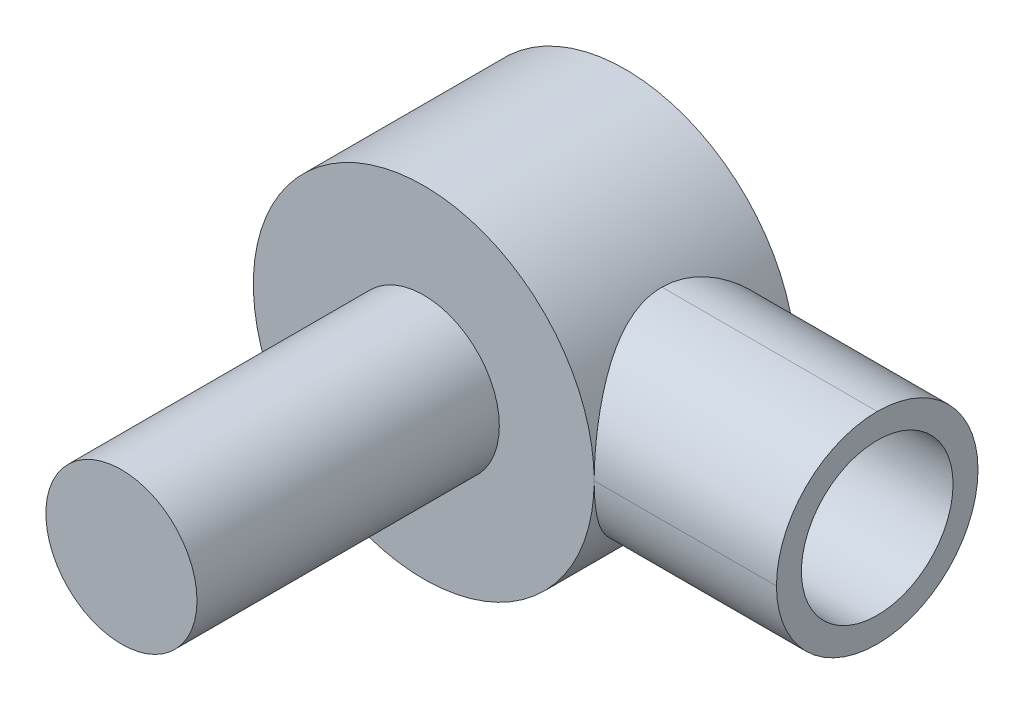
from build123d import *

# Parameters (mm, degrees)
BOSS_EXTRUDE1_DEPTH = 40
SKETCH2_R           = 15.05
CUT_EXTRUDE1_DEPTH  = 40
FILLET1_R           = 20
SKETCH3_R           = 15
BOSS_EXTRUDE2_DEPTH = 60


with BuildPart() as part:
    # Sketch1 → Boss-Extrude1 (new body)
    with BuildSketch(Plane.XY):
        with BuildLine():
            Line((27.270825141, -20), (70, -20))
            Line((70, -20), (70, 20))
            Line((70, 20), (27.270825141, 20))
            ThreePointArc((27.270825141, 20), (-33.818602926, 0), (27.270825141, -20))
        make_face()
    extrude(amount=BOSS_EXTRUDE1_DEPTH)

    # Sketch2 → Cut-Extrude1 (cut)
    with BuildSketch(Plane(origin=(70, 0, 0), x_dir=(0, 0, -1), z_dir=(1, 0, 0))):
        with Locations((-20, 0)):
            Circle(SKETCH2_R)
    extrude(amount=-CUT_EXTRUDE1_DEPTH, mode=Mode.SUBTRACT)

    # Fillet1
    fillet1_edges = [part.edges().sort_by_distance(p)[0] for p in [
        (48.635412571, 20, 40),
        (48.635412571, -20, 40),
        (48.635412571, -20, 0),
        (48.635412571, 20, 0),
    ]]
    fillet(fillet1_edges, radius=FILLET1_R - 0.0001)  # a hair under: the kernel refuses the full size

    # Sketch3 → Boss-Extrude2 (add)
    with BuildSketch(Plane.XY.offset(40)):
        Circle(SKETCH3_R)
    extrude(amount=BOSS_EXTRUDE2_DEPTH)


solid = part.part
